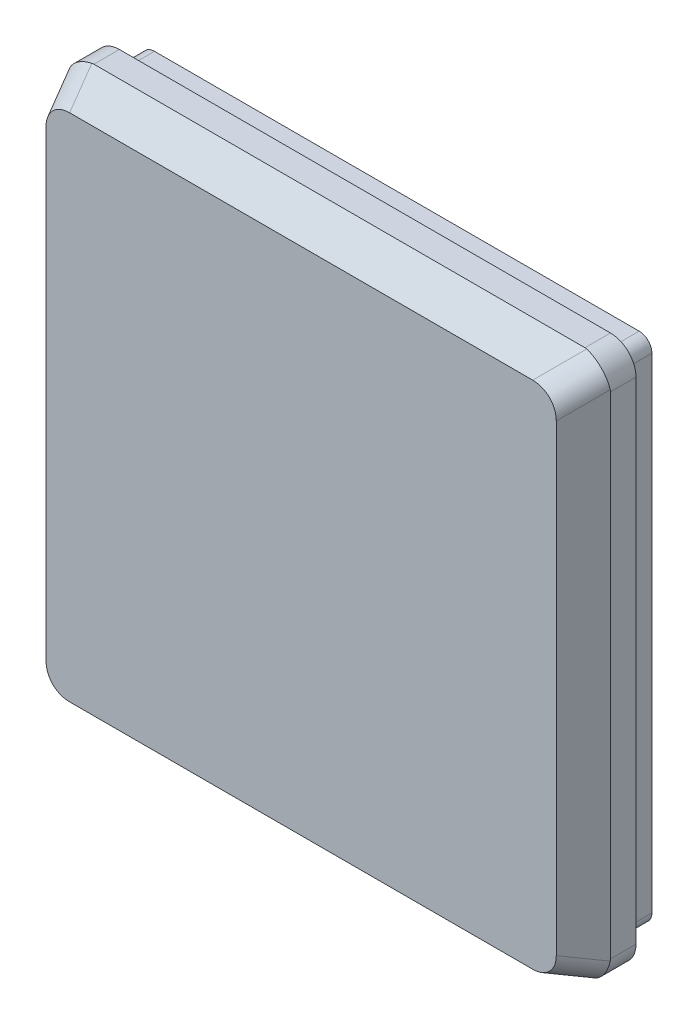
from build123d import *
from OCP.BRepFilletAPI import BRepFilletAPI_MakeChamfer

# Parameters (mm, degrees)
SKIZZE1_W                       = 160
SKIZZE1_H                       = 160
AUFSATZ_LINEAR_AUSTRAGEN1_DEPTH = 10
SKIZZE2_W                       = 170
SKIZZE2_H                       = 170
AUFSATZ_LINEAR_AUSTRAGEN2_DEPTH = 20
FASE1_SIZE                      = 12
FASE1_SIZE2                     = 5
VERRUNDUNG1_R                   = 8
VERRUNDUNG2_R                   = 4


with BuildPart() as part:
    # Skizze1 → Aufsatz-Linear austragen1 (new body)
    with BuildSketch(Plane.XY):
        Rectangle(SKIZZE1_W, SKIZZE1_H)
    extrude(amount=AUFSATZ_LINEAR_AUSTRAGEN1_DEPTH)

    # Skizze2 → Aufsatz-Linear austragen2 (add)
    with BuildSketch(Plane.XY.offset(10)):
        Rectangle(SKIZZE2_W, SKIZZE2_H)
    extrude(amount=AUFSATZ_LINEAR_AUSTRAGEN2_DEPTH)

    # Fase1: one chamfer whose edges measure the first distance from different faces: ONE call of the kernel's chamfer builder (chamfer() names one face for all edges)
    fase1_edges_1 = [part.edges().sort_by_distance(p)[0] for p in [
        (85, 0, 30),
    ]]
    fase1_side_1 = [part.faces().sort_by_distance(p)[0] for p in [
        (85, 0, 20),
    ]]
    fase1_edges_2 = [part.edges().sort_by_distance(p)[0] for p in [
        (0, 85, 30),
    ]]
    fase1_side_2 = [part.faces().sort_by_distance(p)[0] for p in [
        (0, 85, 20),
    ]]
    fase1_edges_3 = [part.edges().sort_by_distance(p)[0] for p in [
        (-85, 0, 30),
    ]]
    fase1_side_3 = [part.faces().sort_by_distance(p)[0] for p in [
        (-85, 0, 20),
    ]]
    fase1_edges_4 = [part.edges().sort_by_distance(p)[0] for p in [
        (0, -85, 30),
    ]]
    fase1_side_4 = [part.faces().sort_by_distance(p)[0] for p in [
        (0, -85, 20),
    ]]
    fase1 = BRepFilletAPI_MakeChamfer(part.part.solid().wrapped)
    for e in fase1_edges_1:
        fase1.Add(FASE1_SIZE, FASE1_SIZE2, e.wrapped, fase1_side_1[0].wrapped)  # the first distance lies on this face
    for e in fase1_edges_2:
        fase1.Add(FASE1_SIZE, FASE1_SIZE2, e.wrapped, fase1_side_2[0].wrapped)  # the first distance lies on this face
    for e in fase1_edges_3:
        fase1.Add(FASE1_SIZE, FASE1_SIZE2, e.wrapped, fase1_side_3[0].wrapped)  # the first distance lies on this face
    for e in fase1_edges_4:
        fase1.Add(FASE1_SIZE, FASE1_SIZE2, e.wrapped, fase1_side_4[0].wrapped)  # the first distance lies on this face
    add(Compound.cast(fase1.Shape()), mode=Mode.REPLACE)

    # Verrundung1
    # the kernel refuses this fillet: 8 mm, written as the material it takes off along each edge
    with BuildSketch(Plane(origin=(85, 85, -10), x_dir=(0, -1, 0), z_dir=(0, 0, 1)), Plane(origin=(85, -85, -10), x_dir=(-1, 0, 0), z_dir=(0, 0, 1))) as verrundung1_piece_1:
        with BuildLine():
            CenterArc((VERRUNDUNG1_R, -VERRUNDUNG1_R), VERRUNDUNG1_R, 90, 90)
            Line((0, -VERRUNDUNG1_R), (0, 0))
            Line((0, 0), (VERRUNDUNG1_R, 0))
        make_face()
    extrude(amount=48, mode=Mode.SUBTRACT)
    with BuildSketch(Plane(origin=(-85, -85, -10), x_dir=(1, 0, 0), z_dir=(0, 0, 1)), Plane(origin=(-85, 85, -10), x_dir=(0, -1, 0), z_dir=(0, 0, 1))) as verrundung1_piece_2:
        with BuildLine():
            CenterArc((VERRUNDUNG1_R, VERRUNDUNG1_R), VERRUNDUNG1_R, 180, 90)
            Line((0, VERRUNDUNG1_R), (0, 0))
            Line((0, 0), (VERRUNDUNG1_R, 0))
        make_face()
    extrude(amount=48, mode=Mode.SUBTRACT)
    with BuildSketch(Plane(origin=(-91.18556701, -91.18556701, 3.154639175), x_dir=(0.9333456062030596, -0.13806887665725864, -0.331365303977417), z_dir=(0.358979079308869, 0.35897907930886913, 0.8615497903412858)), Plane(origin=(-91.18556701, 91.18556701, 3.154639175), x_dir=(-0.13806887665725653, -0.9333456062030596, -0.3313653039774179), z_dir=(0.35897907930886913, -0.358979079308869, 0.8615497903412858))) as verrundung1_piece_3:
        with BuildLine():
            CenterArc((VERRUNDUNG1_R * 0.861549790341, VERRUNDUNG1_R), VERRUNDUNG1_R, 188.506927756, 81.493072244)
            Line((-VERRUNDUNG1_R * 0.127448193837, VERRUNDUNG1_R * 0.852071005917), (0, 0))
            Line((0, 0), (VERRUNDUNG1_R * 0.861549790341, 0))
        make_face()
    extrude(amount=48.390379891, mode=Mode.SUBTRACT)
    with BuildSketch(Plane(origin=(91.18556701, -91.18556701, 3.154639175), x_dir=(-0.9333456062030596, -0.13806887665725678, -0.331365303977418), z_dir=(-0.35897907930886913, 0.358979079308869, 0.8615497903412858)), Plane(origin=(91.18556701, 91.18556701, 3.154639175), x_dir=(0.13806887665725714, -0.9333456062030596, -0.33136530397741776), z_dir=(-0.358979079308869, -0.35897907930886913, 0.8615497903412858))) as verrundung1_piece_4:
        with BuildLine():
            CenterArc((VERRUNDUNG1_R * 0.861549790341, -VERRUNDUNG1_R), VERRUNDUNG1_R, 90, 81.493072244)
            Line((-VERRUNDUNG1_R * 0.127448193837, -VERRUNDUNG1_R * 0.852071005917), (0, 0))
            Line((0, 0), (VERRUNDUNG1_R * 0.861549790341, 0))
        make_face()
    extrude(amount=48.390379891, mode=Mode.SUBTRACT)

    # Verrundung2
    verrundung2_edges = [part.edges().sort_by_distance(p)[0] for p in [
        (80, -80, 5),
        (-80, -80, 5),
        (-80, 80, 5),
        (80, 80, 5),
    ]]
    fillet(verrundung2_edges, radius=VERRUNDUNG2_R)


solid = part.part
